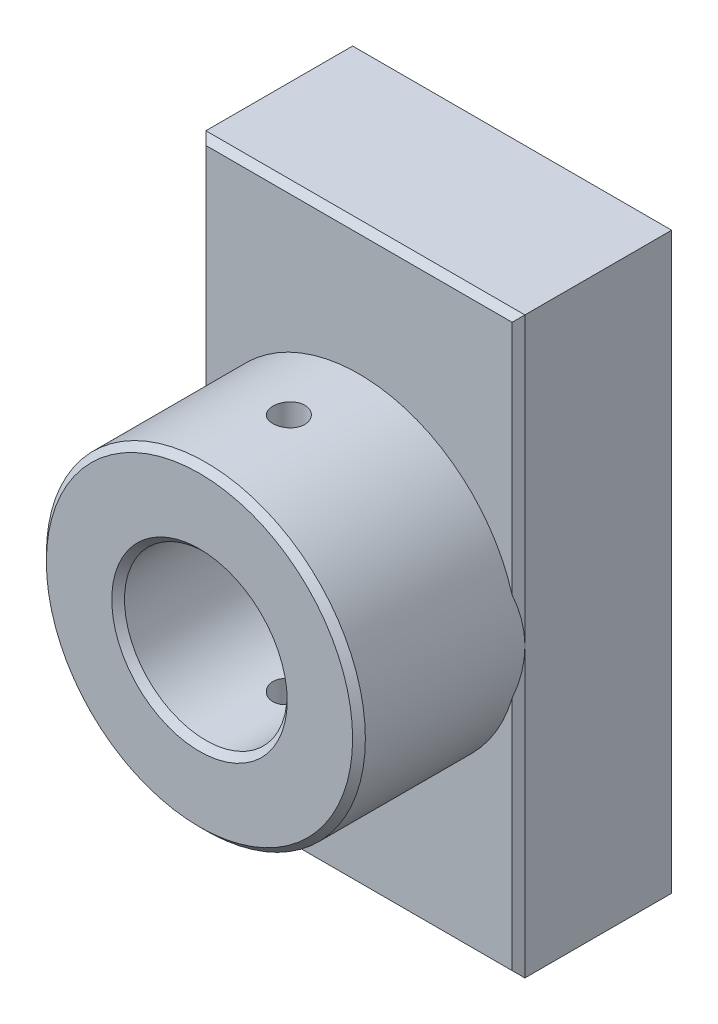
from build123d import *
from build123d.topology import SkipClean

# Parameters (mm, degrees)
SKETCH_1_R               = 25
SKETCH_1_R_2             = 12.75
EXTRUDE_1_DEPTH          = 25
CUT_EXTRUDE_1_DEPTH      = 30
CUT_EXTRUDE_1_DEPTH_BACK = 30
SKETCH_2_R               = 2.5
SKETCH_3_W               = 50
SKETCH_3_H               = 90
EXTRUDE_2_DEPTH          = 25
CHAMFER_1_SIZE           = 1
SKETCH_4_R               = 2.9
CUT_EXTRUDE_2_DEPTH      = 20
CHAMFER_2_SIZE           = 1
SKETCH_5_R               = 2.9
CUT_EXTRUDE_3_DEPTH      = 20
CHAMFER_3_SIZE           = 0.5


with BuildPart() as part:
    # 草图1 → 凸台-拉伸1 (new body)
    with BuildSketch(Plane.XY):
        Circle(SKETCH_1_R)
        Circle(SKETCH_1_R_2, mode=Mode.SUBTRACT)
    extrude(amount=EXTRUDE_1_DEPTH)

    # 草图2 → 切除-拉伸1 (cut, two sides: drawn at the far end of the back side and taken through both)
    with BuildSketch(Plane(origin=(0, 0, 0), x_dir=(1, 0, 0), z_dir=(0, 1, 0)).offset(-CUT_EXTRUDE_1_DEPTH_BACK)):
        with Locations(Location((0, -11, 0), (0, 0, 90))):
            Circle(SKETCH_2_R)
    extrude(amount=CUT_EXTRUDE_1_DEPTH + CUT_EXTRUDE_1_DEPTH_BACK, mode=Mode.SUBTRACT)

    # 草图3 → 凸台-拉伸2 (add)
    with BuildSketch(Plane(origin=(0, 0, 0), x_dir=(-1, 0, 0), z_dir=(0, 0, -1))):
        Rectangle(SKETCH_3_W, SKETCH_3_H)
    extrude(amount=EXTRUDE_2_DEPTH)

    # 倒角1
    chamfer_1_edges = [part.edges().sort_by_distance(p)[0] for p in [
        (-25, 0, 25),
        (-12.75, 0, 25),
    ]]
    chamfer(chamfer_1_edges, length=CHAMFER_1_SIZE)

    # 草图4 → 切除-拉伸2 (cut)
    with BuildSketch(Plane(origin=(0, 0, -25), x_dir=(-1, 0, 0), z_dir=(0, 0, -1))):
        with Locations((2, 0)):
            Circle(SKETCH_4_R)
    extrude(amount=-CUT_EXTRUDE_2_DEPTH, mode=Mode.SUBTRACT)

    # 倒角2
    # the kernel refuses this chamfer: 1 mm, written as the material it takes off along each edge
    with BuildSketch(Plane(origin=(25, 0, 0), x_dir=(-0.9996219169112968, 0, 0.02749587661058639), z_dir=(0, 1, 0))) as chamfer_2_piece_1_section:
        Polygon((CHAMFER_2_SIZE * 0.999621916911, -CHAMFER_2_SIZE * 0.0274958766106), (-CHAMFER_2_SIZE * 0.0274958766106, -CHAMFER_2_SIZE * 0.999621916911), (0, 0), align=None)
    chamfer_2_piece_1 = extrude(amount=47.571682988, mode=Mode.PRIVATE)
    chamfer_2_piece_1 = chamfer_2_piece_1 - Plane(origin=(0, 0, -0.337643677), x_dir=(1, 0, 0), z_dir=(0, 0, -1)) * Cylinder(25, 100, mode=Mode.PRIVATE)
    add(chamfer_2_piece_1, mode=Mode.SUBTRACT)
    with BuildSketch(Plane(origin=(25, -47.571682988, 0), x_dir=(-0.9996219169112968, 0, 0.02749587661058639), z_dir=(0, 1, 0))) as chamfer_2_piece_2_section:
        Polygon((CHAMFER_2_SIZE * 0.999621916911, -CHAMFER_2_SIZE * 0.0274958766106), (-CHAMFER_2_SIZE * 0.0274958766106, -CHAMFER_2_SIZE * 0.999621916911), (0, 0), align=None)
    chamfer_2_piece_2 = extrude(amount=47.571682988, mode=Mode.PRIVATE)
    chamfer_2_piece_2 = chamfer_2_piece_2 - Plane(origin=(0, 0, -0.337643676), x_dir=(1, 0, 0), z_dir=(0, 0, -1)) * Cylinder(25, 100, mode=Mode.PRIVATE)
    add(chamfer_2_piece_2, mode=Mode.SUBTRACT)
    with BuildSketch(Plane(origin=(-27.571682988, -45, 0), x_dir=(0, 0.9996219169112968, 0.027495876610586292), z_dir=(1, 0, 0)), Plane(origin=(27.571682988, 45, 0), x_dir=(0, -0.9996219169112968, 0.027495876610586292), z_dir=(-1, 0, 0)), Plane(origin=(-27.571682988, -45, -25), x_dir=(0, -0.0274958766105891, 0.9996219169112968), z_dir=(1, 0, 0)), Plane(origin=(27.571682988, 45, -25), x_dir=(0, 0.0274958766105891, 0.9996219169112968), z_dir=(-1, 0, 0))) as chamfer_2_piece_3:
        Polygon((CHAMFER_2_SIZE * 0.999621916911, -CHAMFER_2_SIZE * 0.0274958766106), (-CHAMFER_2_SIZE * 0.0274958766106, -CHAMFER_2_SIZE * 0.999621916911), (0, 0), align=None)
    extrude(amount=55.143365976, mode=Mode.SUBTRACT)
    with BuildSketch(Plane(origin=(-25, -1.3e-08, 0), x_dir=(0.9996219169112968, 0, 0.02749587661058639), z_dir=(0, -1, 0))) as chamfer_2_piece_4_section:
        Polygon((CHAMFER_2_SIZE * 0.999621916911, -CHAMFER_2_SIZE * 0.0274958766106), (-CHAMFER_2_SIZE * 0.0274958766106, -CHAMFER_2_SIZE * 0.999621916911), (0, 0), align=None)
    chamfer_2_piece_4 = extrude(amount=47.571682975, mode=Mode.PRIVATE)
    chamfer_2_piece_4 = chamfer_2_piece_4 - Plane(origin=(0, 0, -0.337643677), x_dir=(1, 0, 0), z_dir=(0, 0, -1)) * Cylinder(25, 100, mode=Mode.PRIVATE)
    add(chamfer_2_piece_4, mode=Mode.SUBTRACT)
    with BuildSketch(Plane(origin=(-25, 47.571682988, 0), x_dir=(0.9996219169112968, 0, 0.02749587661058639), z_dir=(0, -1, 0))) as chamfer_2_piece_5_section:
        Polygon((CHAMFER_2_SIZE * 0.999621916911, -CHAMFER_2_SIZE * 0.0274958766106), (-CHAMFER_2_SIZE * 0.0274958766106, -CHAMFER_2_SIZE * 0.999621916911), (0, 0), align=None)
    chamfer_2_piece_5 = extrude(amount=47.571683001, mode=Mode.PRIVATE)
    chamfer_2_piece_5 = chamfer_2_piece_5 - Plane(origin=(0, 0, -0.337643677), x_dir=(1, 0, 0), z_dir=(0, 0, -1)) * Cylinder(25, 100, mode=Mode.PRIVATE)
    add(chamfer_2_piece_5, mode=Mode.SUBTRACT)
    with BuildSketch(Plane(origin=(25, -47.571682988, -25), x_dir=(0.027495876610585647, 0, 0.9996219169112968), z_dir=(0, 1, 0)), Plane(origin=(-25, 47.571682988, -25), x_dir=(-0.027495876610585647, 0, 0.9996219169112968), z_dir=(0, -1, 0))) as chamfer_2_piece_6:
        Polygon((CHAMFER_2_SIZE * 0.999621916911, -CHAMFER_2_SIZE * 0.0274958766106), (-CHAMFER_2_SIZE * 0.0274958766106, -CHAMFER_2_SIZE * 0.999621916911), (0, 0), align=None)
    extrude(amount=95.143365976, mode=Mode.SUBTRACT)
    with BuildSketch(Plane(origin=(-2, 0, -25), x_dir=(-1, 0, 0), z_dir=(0, -1, 0))) as chamfer_2_piece_7:
        Polygon((2.9 + CHAMFER_2_SIZE, 0), (2.9, -CHAMFER_2_SIZE), (2.9, 0), align=None)
    revolve(axis=Axis((-2, 0, -25), (0, 0, -1)), mode=Mode.SUBTRACT)

    # 草图5 → 切除-拉伸3 (cut)
    with SkipClean():  # the faces are left unmerged after this step: merging them gives an invalid solid
        with BuildSketch(Plane(origin=(0, 0, -25), x_dir=(-1, 0, 0), z_dir=(0, 0, -1))):
            with Locations((2, 34)):
                Circle(SKETCH_5_R)
            with Locations((2, -34)):
                Circle(SKETCH_5_R)
        extrude(amount=-CUT_EXTRUDE_3_DEPTH, mode=Mode.SUBTRACT)

    # 倒角3
    chamfer_3_edges = [part.edges().sort_by_distance(p)[0] for p in [
        (0.9, 34, -25),
        (0.9, -34, -25),
    ]]
    chamfer(chamfer_3_edges, length=CHAMFER_3_SIZE)


solid = part.part
